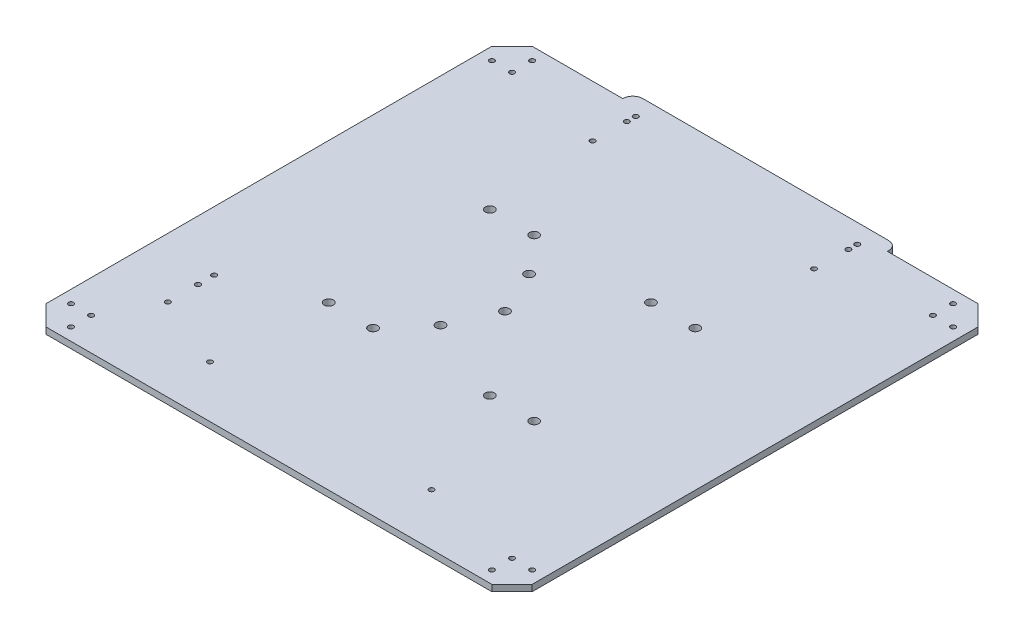
from build123d import *

# Parameters (mm, degrees)
BOSS_EXTRUDE1_DEPTH      = 3.175
SKETCH2_R                = 1.5
SKETCH2_R_2              = 2.25
CUT_EXTRUDE1_DEPTH       = 171.725102504
M3X0_5_TAPPED_HOLE1_D    = 2.5
SKETCH5_R                = 1.25
CUT_EXTRUDE2_DEPTH       = 171.725102504
SKETCH6_R                = 1.25
CUT_EXTRUDE3_DEPTH       = 10
M4_CLEARANCE_HOLE1_D     = 4.5
M4_CLEARANCE_HOLE1_DEPTH = 10
M4_CLEARANCE_HOLE1_TIP   = 1.351936393
M3X0_5_TAPPED_HOLE2_D    = 2.5
SKETCH15_W               = 131.4
SKETCH15_H               = 3.175
BOSS_EXTRUDE2_DEPTH      = 5
FILLET1_R                = 5
FILLET2_SIZE             = 5


# Some blends are built 0.0001 mm under size
with BuildPart() as part:
    # Sketch1 → Boss-Extrude1 (new body)
    with BuildSketch(Plane(origin=(0, 0, 0), x_dir=(1, 0, 0), z_dir=(0, 1, 0))):
        Polygon((-110.7, 120.7), (110.7, 120.7), (120.7, 110.7), (120.7, -110.7), (110.7, -120.7), (-110.7, -120.7), (-120.7, -110.7), (-120.7, 110.7), align=None)
    extrude(amount=BOSS_EXTRUDE1_DEPTH)

    # Sketch2 → Cut-Extrude1 (cut, through all)
    with BuildSketch(Plane(origin=(0, 3.175, 0), x_dir=(1, 0, 0), z_dir=(0, 1, 0))):
        with Locations(Location((-51, -40, 0), (0, 0, 270))):
            Circle(SKETCH2_R)
        with Locations(Location((-29, -40, 0), (0, 0, 270))):
            Circle(SKETCH2_R_2)
        with Locations(Location((-51, 40, 0), (0, 0, 270))):
            Circle(SKETCH2_R)
        with Locations(Location((-29, 40, 0), (0, 0, 270))):
            Circle(SKETCH2_R_2)
        with Locations(Location((29, 40, 0), (0, 0, 270))):
            Circle(SKETCH2_R_2)
        with Locations(Location((51, 40, 0), (0, 0, 270))):
            Circle(SKETCH2_R_2)
        with Locations(Location((29, -40, 0), (0, 0, 270))):
            Circle(SKETCH2_R_2)
        with Locations(Location((51, -40, 0), (0, 0, 270))):
            Circle(SKETCH2_R_2)
        with Locations(Location((-3.5, 0, 0), (0, 0, 270))):
            Circle(SKETCH2_R_2)
        with Locations(Location((-13.5, 22, 0), (0, 0, 270))):
            Circle(SKETCH2_R_2)
        with Locations(Location((-13.5, -22, 0), (0, 0, 270))):
            Circle(SKETCH2_R_2)
    extrude(amount=-CUT_EXTRUDE1_DEPTH, mode=Mode.SUBTRACT)

    # M3x0.5 Tapped Hole1 (through all)
    with Locations(Plane(origin=(0, 3.175, 0), x_dir=(-1, 0, 0), z_dir=(0, 1, 0))):
        with Locations((114.5, -104.5), (104.5, -114.5), (-104.5, -114.5), (-114.5, -104.5), (-114.5, 104.5), (-104.5, 114.5), (104.5, 114.5), (114.5, 104.5), (-104.5, 104.5), (-104.5, -104.5), (104.5, -104.5), (104.5, 104.5)):
            Hole(M3X0_5_TAPPED_HOLE1_D / 2)

    # Sketch5 → Cut-Extrude2 (cut, through all)
    with BuildSketch(Plane(origin=(0, 3.175, 0), x_dir=(1, 0, 0), z_dir=(0, 1, 0))):
        with Locations(Location((-55, 95, 0), (0, 0, 270))):
            Circle(SKETCH5_R)
        with Locations(Location((55, 95, 0), (0, 0, 270))):
            Circle(SKETCH5_R)
        with Locations(Location((-55, -95, 0), (0, 0, 270))):
            Circle(SKETCH5_R)
        with Locations(Location((55, -95, 0), (0, 0, 270))):
            Circle(SKETCH5_R)
    extrude(amount=-CUT_EXTRUDE2_DEPTH, mode=Mode.SUBTRACT)

    # Sketch6 → Cut-Extrude3 (cut)
    with BuildSketch(Plane(origin=(0, 3.175, 0), x_dir=(1, 0, 0), z_dir=(0, 1, 0))):
        with Locations(Location((-91.2, -64.7, 0), (0, 0, 270))):
            Circle(SKETCH6_R)
        with Locations(Location((-91.2, -56.7, 0), (0, 0, 270))):
            Circle(SKETCH6_R)
        with Locations(Location((-91.2, -79.7, 0), (0, 0, 270))):
            Circle(SKETCH6_R)
    extrude(amount=-CUT_EXTRUDE3_DEPTH, mode=Mode.SUBTRACT)

    # M4 Clearance Hole1
    with Locations(Plane(origin=(0, 3.175, 0), x_dir=(-1, 0, 0), z_dir=(0, 1, 0))):
        with Locations((51, -40), (51, 40)):
            Hole(M4_CLEARANCE_HOLE1_D / 2, depth=M4_CLEARANCE_HOLE1_DEPTH)
            with Locations((0, 0, -(M4_CLEARANCE_HOLE1_DEPTH + M4_CLEARANCE_HOLE1_TIP / 2))):  # 118° drill point
                Cone(0, M4_CLEARANCE_HOLE1_D / 2, M4_CLEARANCE_HOLE1_TIP, mode=Mode.SUBTRACT)

    # M3x0.5 Tapped Hole2 (through all)
    with Locations(Plane(origin=(0, 3.175, 0), x_dir=(-1, 0, 0), z_dir=(0, 1, 0))):
        with Locations((-55.188488938, -111.84444349), (54.811511062, -111.84444349), (-55.188488938, -116.267236791), (54.811511062, -116.267236791)):
            Hole(M3X0_5_TAPPED_HOLE2_D / 2)

    # Sketch15 → Boss-Extrude2 (add)
    with BuildSketch(Plane(origin=(0, 0, -120.7), x_dir=(-1, 0, 0), z_dir=(0, 0, -1))):
        with Locations((0, 1.5875)):
            Rectangle(SKETCH15_W, SKETCH15_H)
    extrude(amount=BOSS_EXTRUDE2_DEPTH)

    # Fillet1
    fillet1_edges = [part.edges().sort_by_distance(p)[0] for p in [
        (-65.7, 1.5875, -125.7),
    ]]
    fillet(fillet1_edges, radius=FILLET1_R - 0.0001)  # a hair under: the kernel refuses the full size

    # Fillet2
    # a fillet whose section is not a circle: 5 mm, written as the material it takes off along each edge
    with BuildSketch(Plane(origin=(65.7, -12.5, -125.7), x_dir=(-1, 0, 0), z_dir=(0, 1, 0))) as fillet2_piece_1:
        with BuildLine():
            Bezier((FILLET2_SIZE, 0), (0, 0), (0, FILLET2_SIZE), weights=[1, 1, 1])
            Line((0, FILLET2_SIZE), (0, 0))
            Line((0, 0), (FILLET2_SIZE, 0))
        make_face()
    extrude(amount=28.175, mode=Mode.SUBTRACT)


solid = part.part
